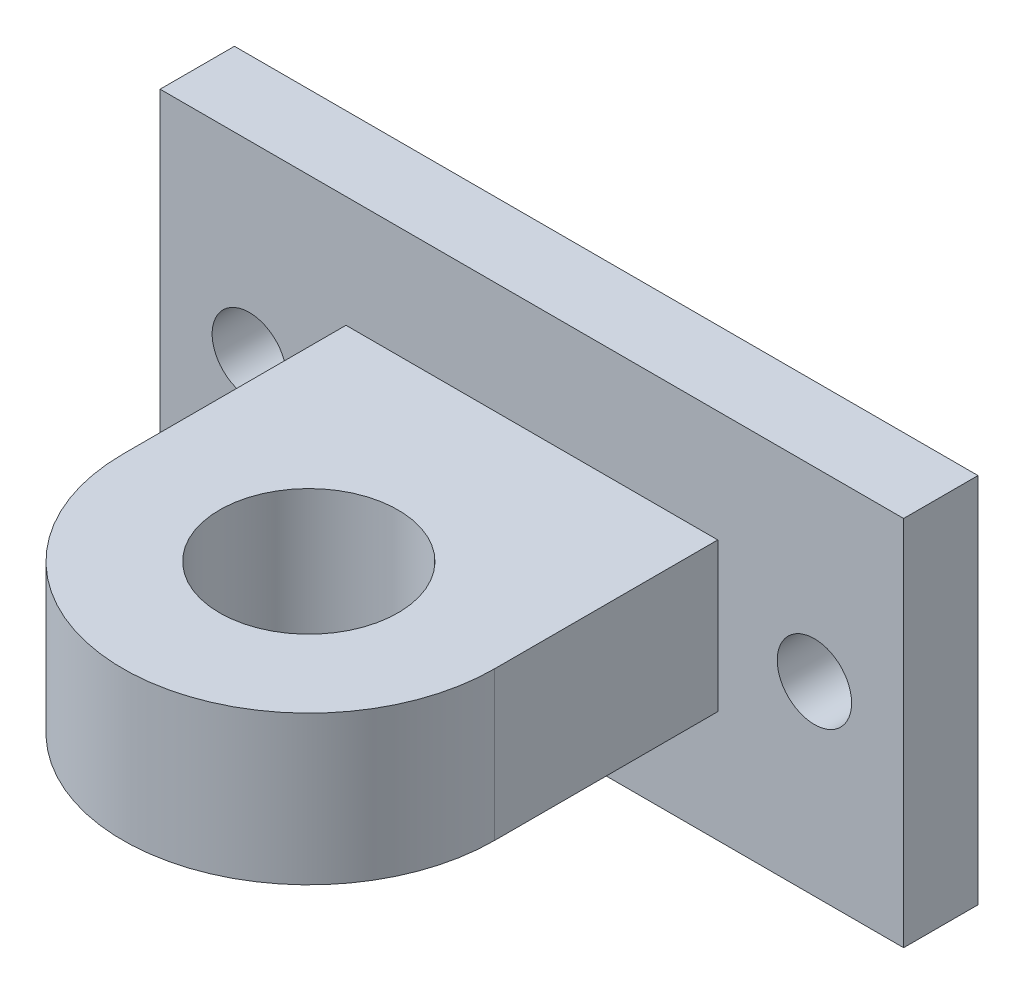
from build123d import *

# Parameters (mm, degrees)
SKETCH_1_W          = 100
SKETCH_1_H          = 50
EXTRUDE_1_DEPTH     = 10
EXTRUDE_START       = -10
EXTRUDE_2_DEPTH     = 20
SKETCH_3_R          = 12
CUT_EXTRUDE_1_DEPTH = 101
SKETCH_4_R          = 5
CUT_EXTRUDE_2_DEPTH = 86.732140997


# Read off the part's stored shape, not the designer's step: 凸台-拉伸2
with BuildPart() as part:
    # 草图1 → 凸台-拉伸1 (new body)
    with BuildSketch(Plane.XY):
        Rectangle(SKETCH_1_W, SKETCH_1_H)
    extrude(amount=EXTRUDE_1_DEPTH)

    # 凸台-拉伸2 outline → 凸台-拉伸2 (add)
    with BuildSketch(Plane(origin=(0, 0, 0), x_dir=(1, 0, 0), z_dir=(0, 1, 0)).offset(EXTRUDE_START)):
        with BuildLine():
            Line((-25, -10), (-25, -40))
            ThreePointArc((-25, -40), (0, -65), (25, -40))
            Line((25, -40), (25, -10))
            Line((25, -10), (-25, -10))
        make_face()
    extrude(amount=EXTRUDE_2_DEPTH)

    # 草图3 → 切除-拉伸1 (cut, symmetric)
    with BuildSketch(Plane(origin=(0, 0, 0), x_dir=(1, 0, 0), z_dir=(0, 1, 0))):
        with Locations(Location((0, -40, 0), (0, 0, 270))):
            Circle(SKETCH_3_R)
    extrude(amount=CUT_EXTRUDE_1_DEPTH, both=True, mode=Mode.SUBTRACT)

    # 草图4 → 切除-拉伸2 (cut, through all)
    with BuildSketch(Plane.XY):
        with Locations((-38, 0)):
            Circle(SKETCH_4_R)
        with Locations((38, 0)):
            Circle(SKETCH_4_R)
    extrude(amount=CUT_EXTRUDE_2_DEPTH, mode=Mode.SUBTRACT)


solid = part.part
